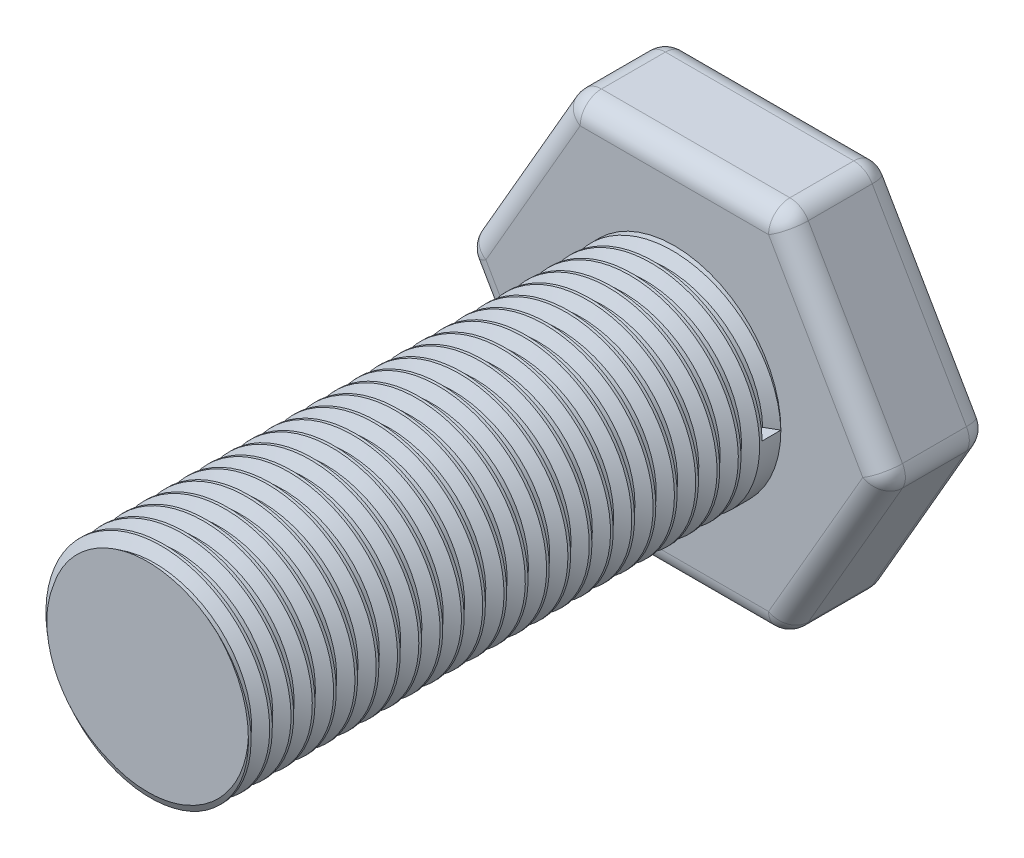
from build123d import *

# Parameters (mm, degrees)
BOSS_EXTRU_1_DEPTH = 5
ESQUISSE3_R        = 5
BOSS_EXTRU_2_DEPTH = 25
FILETAGE1_PITCH    = 1
CONG_1_R           = 1


with BuildPart() as part:
    # Esquisse2 → Boss.-Extru.1 (new body)
    with BuildSketch(Plane.XY):
        Polygon((5, 8.660254038), (-5, 8.660254038), (-10, 0), (-5, -8.660254038), (5, -8.660254038), (10, 0), align=None)
    extrude(amount=BOSS_EXTRU_1_DEPTH)

    # Esquisse3 → Boss.-Extru.2 (add)
    with BuildSketch(Plane.XY.offset(5)):
        Circle(ESQUISSE3_R)
    extrude(amount=BOSS_EXTRU_2_DEPTH)

    # Filetage1: the profile of Profil de filetage2 profile screwed along a right-hand helix of 25 turns, 8 arcs to a turn; built about Z, then put on its axis
    filetage1_z = Axis((0, 0, 0), (0, 0, 1))
    filetage1_corners = [(5.0003, 0, -0.000173205), (5.0003, 0, 0.875173202), (4.458734125, 0, 0.562499999), (4.458734125, 0, 0.312499999)]
    with BuildLine(mode=Mode.PRIVATE) as filetage1_profile:
        Line(filetage1_corners[0], filetage1_corners[1])
        Line(filetage1_corners[1], filetage1_corners[2])
        Line(filetage1_corners[2], filetage1_corners[3])
        Line(filetage1_corners[3], filetage1_corners[0])
    filetage1_cap = Face(filetage1_profile.wire())
    filetage1_turn_angles = [0, 22.5, 45, 67.5, 90, 112.5, 135, 157.5, 180, 202.5, 225, 247.5, 270, 292.5, 315, 337.5, 360]
    filetage1_turn_weights = [1, 0.9238795325112867, 1, 0.9238795325112867, 1, 0.9238795325112867, 1, 0.9238795325112867, 1, 0.9238795325112867, 1, 0.9238795325112867, 1, 0.9238795325112867, 1, 0.9238795325112867, 1]
    filetage1_turn_rails = [Edge.make_bspline([Vector(p[0], p[1], 0).rotate(filetage1_z, filetage1_turn_angles[k]) / filetage1_turn_weights[k] + Vector(0, 0, p[2] + FILETAGE1_PITCH * filetage1_turn_angles[k] / 360) for k in range(17)], [0, 0, 0, 1, 1, 2, 2, 3, 3, 4, 4, 5, 5, 6, 6, 7, 7, 8, 8, 8], 2, filetage1_turn_weights) for p in filetage1_corners]
    filetage1_turn_sides = [Face.make_surface_from_curves(filetage1_turn_rails[p[0]], filetage1_turn_rails[p[1]]) for p in [(0, 1), (1, 2), (2, 3), (3, 0)]]
    filetage1 = Plane(origin=(0, 0, 5), x_dir=(1, 0, 0), z_dir=(0, 0, 1)) * Solid(Shell([*[p.moved(Location((0, 0, FILETAGE1_PITCH * i))) for i in range(25) for p in filetage1_turn_sides], filetage1_cap, filetage1_cap.rotate(filetage1_z, 9000).moved(Location((0, 0, FILETAGE1_PITCH * 9000 / 360)))]))
    add(filetage1, mode=Mode.SUBTRACT)

    # Congé1
    cong_1_edges = [part.edges().sort_by_distance(p)[0] for p in [
        (10, 0, 2.5),
        (5, -8.660254038, 2.5),
        (-5, -8.660254038, 2.5),
        (-10, 0, 2.5),
        (-5, 8.660254038, 2.5),
        (5, 8.660254038, 2.5),
        (-7.5, 4.330127019, 5),
        (-7.5, -4.330127019, 5),
        (0, -8.660254038, 5),
        (7.5, -4.330127019, 5),
        (7.5, 4.330127019, 5),
        (7.5, -4.330127019, 0),
        (0, -8.660254038, 0),
        (-7.5, -4.330127019, 0),
        (-7.5, 4.330127019, 0),
        (0, 8.660254038, 0),
        (7.5, 4.330127019, 0),
        (0, 8.660254038, 5),
    ]]
    fillet(cong_1_edges, radius=CONG_1_R)


solid = part.part
